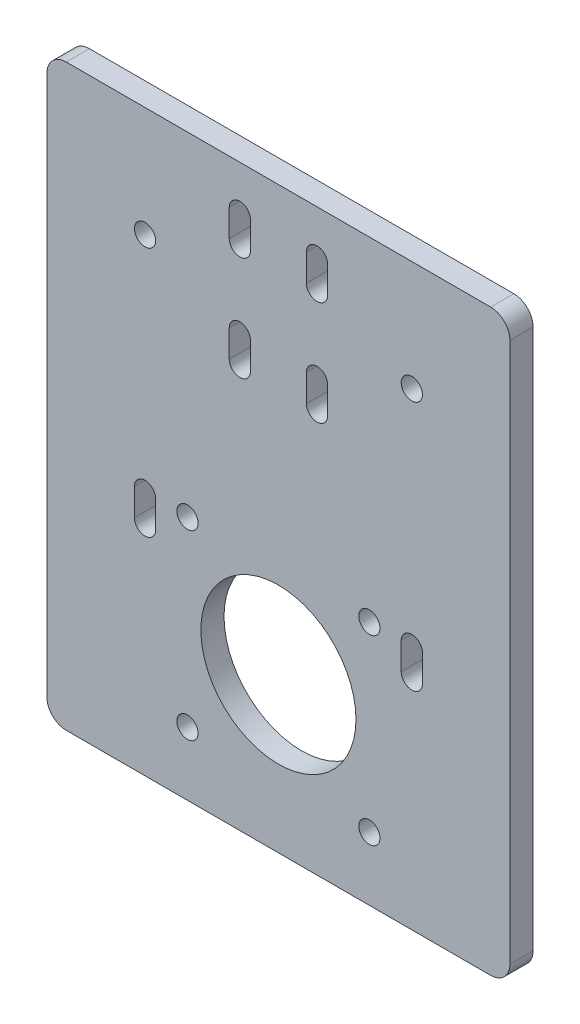
from build123d import *

# Parameters (mm, degrees)
BOSS_EXTRUDE1_DEPTH  = 6
SKETCH4_R            = 20.1
CUT_EXTRUDE1_DEPTH   = 39.2
M5_CLEARANCE_HOLE1_D = 5.5
CUT_EXTRUDE2_DEPTH   = 6
M5_CLEARANCE_HOLE2_D = 5.5
CUT_EXTRUDE3_DEPTH   = 6


with BuildPart() as part:
    # Sketch3 → Boss-Extrude1 (new body)
    with BuildSketch(Plane.XY):
        with BuildLine():
            Line((-55, -75), (55, -75))
            ThreePointArc((55, -75), (58.535533906, -73.535533906), (60, -70))
            Line((60, -70), (60, 70))
            ThreePointArc((60, 70), (58.535533906, 73.535533906), (55, 75))
            Line((55, 75), (-55, 75))
            ThreePointArc((-55, 75), (-58.535533906, 73.535533906), (-60, 70))
            Line((-60, 70), (-60, -70))
            ThreePointArc((-60, -70), (-58.535533906, -73.535533906), (-55, -75))
        make_face()
    extrude(amount=BOSS_EXTRUDE1_DEPTH)

    # Sketch4 → Cut-Extrude1 (cut)
    with BuildSketch(Plane.XY.offset(6)):
        with Locations((0, -35)):
            Circle(SKETCH4_R)
    extrude(amount=-CUT_EXTRUDE1_DEPTH, mode=Mode.SUBTRACT)

    # M5 Clearance Hole1 (through all)
    with Locations(Plane.XY.offset(6)):
        with Locations((-23.57, -11.43), (23.57, -11.43), (23.57, -58.57), (-23.57, -58.57)):
            Hole(M5_CLEARANCE_HOLE1_D / 2)

    # Sketch7 → Cut-Extrude2 (cut)
    with BuildSketch(Plane.XY.offset(6)):
        with BuildLine():
            Line((-31.82, -11.43), (-31.82, -18.43))
            ThreePointArc((-31.82, -18.43), (-34.57, -21.18), (-37.32, -18.43))
            Line((-37.32, -18.43), (-37.32, -11.43))
            ThreePointArc((-37.32, -11.43), (-34.57, -8.68), (-31.82, -11.43))
        make_face()
        with BuildLine():
            Line((31.82, -11.43), (31.82, -18.43))
            ThreePointArc((31.82, -18.43), (34.57, -21.18), (37.32, -18.43))
            Line((37.32, -18.43), (37.32, -11.43))
            ThreePointArc((37.32, -11.43), (34.57, -8.68), (31.82, -11.43))
        make_face()
    extrude(amount=-CUT_EXTRUDE2_DEPTH, mode=Mode.SUBTRACT)

    # M5 Clearance Hole2 (through all)
    with Locations(Plane.XY.offset(6)):
        with Locations((-34.57, 46.47), (34.57, 46.47)):
            Hole(M5_CLEARANCE_HOLE2_D / 2)

    # Sketch10 → Cut-Extrude3 (cut)
    with BuildSketch(Plane.XY.offset(6)):
        with BuildLine():
            Line((-7.25, 63.5), (-7.25, 56.5))
            ThreePointArc((-7.25, 56.5), (-10, 53.75), (-12.75, 56.5))
            Line((-12.75, 56.5), (-12.75, 63.5))
            ThreePointArc((-12.75, 63.5), (-10, 66.25), (-7.25, 63.5))
        make_face()
        with BuildLine():
            Line((12.75, 63.5), (12.75, 56.5))
            ThreePointArc((12.75, 56.5), (10, 53.75), (7.25, 56.5))
            Line((7.25, 56.5), (7.25, 63.5))
            ThreePointArc((7.25, 63.5), (10, 66.25), (12.75, 63.5))
        make_face()
        with BuildLine():
            Line((-7.25, 29.44), (-7.25, 36.44))
            ThreePointArc((-7.25, 36.44), (-10, 39.19), (-12.75, 36.44))
            Line((-12.75, 36.44), (-12.75, 29.44))
            ThreePointArc((-12.75, 29.44), (-10, 26.69), (-7.25, 29.44))
        make_face()
        with BuildLine():
            Line((12.75, 29.44), (12.75, 36.44))
            ThreePointArc((12.75, 36.44), (10, 39.19), (7.25, 36.44))
            Line((7.25, 36.44), (7.25, 29.44))
            ThreePointArc((7.25, 29.44), (10, 26.69), (12.75, 29.44))
        make_face()
    extrude(amount=-CUT_EXTRUDE3_DEPTH, mode=Mode.SUBTRACT)


solid = part.part
